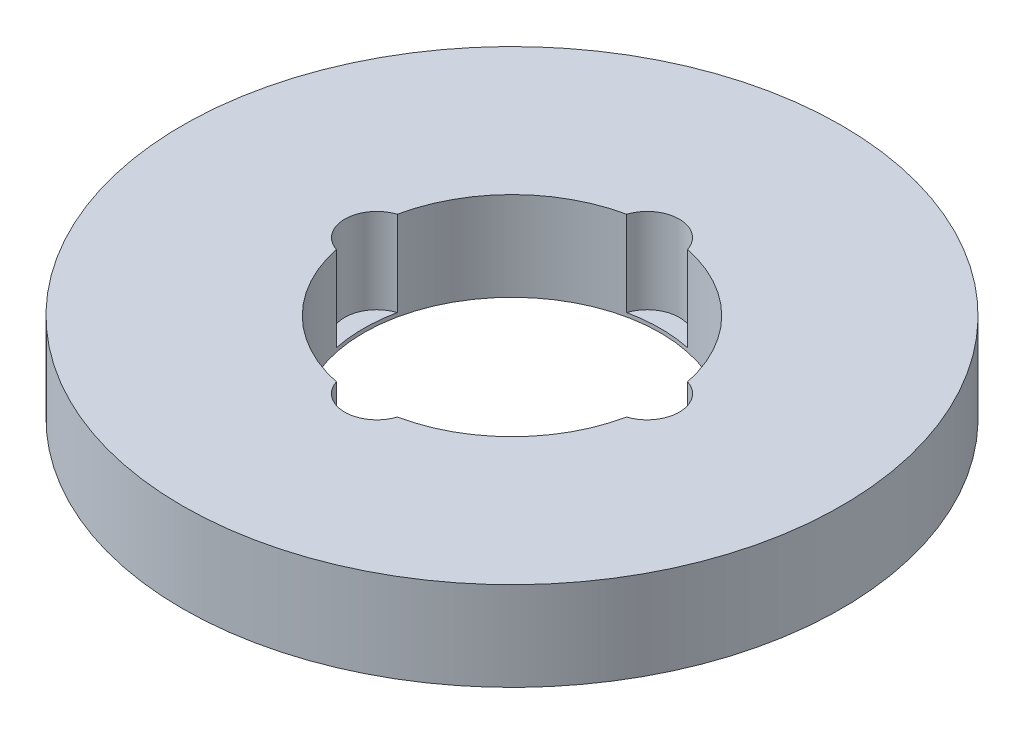
from build123d import *

# Parameters (mm, degrees)
SKETCH1_R           = 100
BOSS_EXTRUDE1_DEPTH = 27
SKETCH2_R           = 45
CUT_EXTRUDE1_DEPTH  = 144.975692393
SKETCH3_R           = 9.741273523
CUT_EXTRUDE2_DEPTH  = 25.83762907
CIRPATTERN1_COUNT   = 4


with BuildPart() as part:
    # Sketch1 → Boss-Extrude1 (new body)
    with BuildSketch(Plane(origin=(0, 0, 0), x_dir=(1, 0, 0), z_dir=(0, 1, 0))):
        Circle(SKETCH1_R)
    extrude(amount=BOSS_EXTRUDE1_DEPTH)

    # Sketch2 → Cut-Extrude1 (cut, through all)
    with BuildSketch(Plane(origin=(0, 0, 0), x_dir=(1, 0, 0), z_dir=(0, 1, 0))):
        Circle(SKETCH2_R)
    extrude(amount=CUT_EXTRUDE1_DEPTH, mode=Mode.SUBTRACT)

    # Sketch3 → Cut-Extrude2 (cut)
    with BuildSketch(Plane(origin=(0, 27, 0), x_dir=(1, 0, 0), z_dir=(0, 1, 0))):
        with Locations((-41.007683576, 0)):
            Circle(SKETCH3_R)
    cut_extrude2 = extrude(amount=-CUT_EXTRUDE2_DEPTH, mode=Mode.SUBTRACT)

    # CirPattern1: Cut-Extrude2 ×4 about axis
    cirpattern1_axis = Axis((0, 0, 0), (0, 1, 0))
    for i in range(1, CIRPATTERN1_COUNT):
        add(cut_extrude2.rotate(cirpattern1_axis, i * 360 / CIRPATTERN1_COUNT), mode=Mode.SUBTRACT)


solid = part.part
